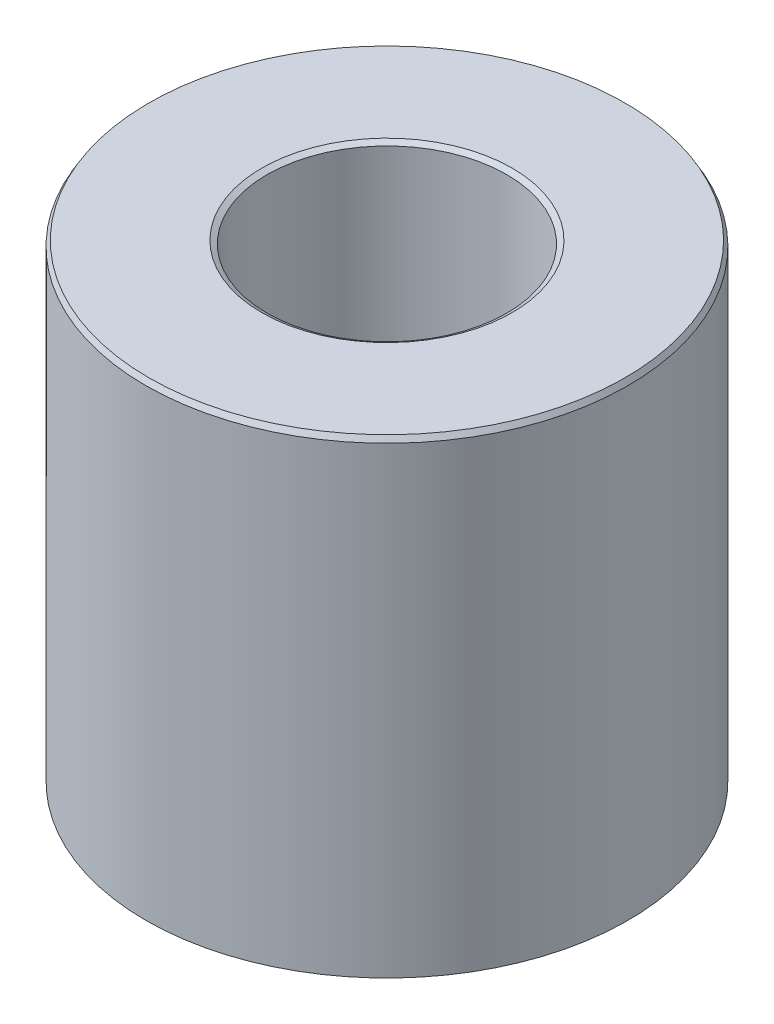
from build123d import *
from OCP.BRepFilletAPI import BRepFilletAPI_MakeChamfer

# Parameters (mm, degrees)
SKETCH1_R           = 60
BOSS_EXTRUDE1_DEPTH = 117.326546459
SKETCH2_R           = 29.848860848
CUT_EXTRUDE1_DEPTH  = 145.79474612
CHAMFER1_SIZE       = 1.310806457
CHAMFER1_SIZE2      = 0.756794461


with BuildPart() as part:
    # Sketch1 → Boss-Extrude1 (new body)
    with BuildSketch(Plane(origin=(0, 0, 0), x_dir=(1, 0, 0), z_dir=(0, 1, 0))):
        Circle(SKETCH1_R)
    extrude(amount=BOSS_EXTRUDE1_DEPTH)

    # Sketch2 → Cut-Extrude1 (cut, through all)
    with BuildSketch(Plane(origin=(0, 0, 0), x_dir=(1, 0, 0), z_dir=(0, 1, 0))):
        Circle(SKETCH2_R)
    extrude(amount=CUT_EXTRUDE1_DEPTH, mode=Mode.SUBTRACT)

    # Chamfer1: one chamfer whose edges measure the first distance from different faces: ONE call of the kernel's chamfer builder (chamfer() names one face for all edges)
    chamfer1_edges_1 = [part.edges().sort_by_distance(p)[0] for p in [
        (-29.848860848, 117.326546459, 0),
    ]]
    chamfer1_side_1 = [part.faces().sort_by_distance(p)[0] for p in [
        (-58.302943725, 117.326546459, 0),
    ]]
    chamfer1_edges_2 = [part.edges().sort_by_distance(p)[0] for p in [
        (-29.848860848, 0, 0),
    ]]
    chamfer1_side_2 = [part.faces().sort_by_distance(p)[0] for p in [
        (-29.848860848, 58.66327323, 0),
    ]]
    chamfer1_edges_3 = [part.edges().sort_by_distance(p)[0] for p in [
        (-60, 0, 0),
    ]]
    chamfer1_side_3 = [part.faces().sort_by_distance(p)[0] for p in [
        (-58.302943725, 0, 0),
    ]]
    chamfer1_edges_4 = [part.edges().sort_by_distance(p)[0] for p in [
        (-60, 117.326546459, 0),
    ]]
    chamfer1_side_4 = [part.faces().sort_by_distance(p)[0] for p in [
        (-60, 58.66327323, 0),
    ]]
    chamfer1 = BRepFilletAPI_MakeChamfer(part.part.solid().wrapped)
    for e in chamfer1_edges_1:
        chamfer1.Add(CHAMFER1_SIZE, CHAMFER1_SIZE2, e.wrapped, chamfer1_side_1[0].wrapped)  # the first distance lies on this face
    for e in chamfer1_edges_2:
        chamfer1.Add(CHAMFER1_SIZE, CHAMFER1_SIZE2, e.wrapped, chamfer1_side_2[0].wrapped)  # the first distance lies on this face
    for e in chamfer1_edges_3:
        chamfer1.Add(CHAMFER1_SIZE, CHAMFER1_SIZE2, e.wrapped, chamfer1_side_3[0].wrapped)  # the first distance lies on this face
    for e in chamfer1_edges_4:
        chamfer1.Add(CHAMFER1_SIZE, CHAMFER1_SIZE2, e.wrapped, chamfer1_side_4[0].wrapped)  # the first distance lies on this face
    add(Compound.cast(chamfer1.Shape()), mode=Mode.REPLACE)


solid = part.part
